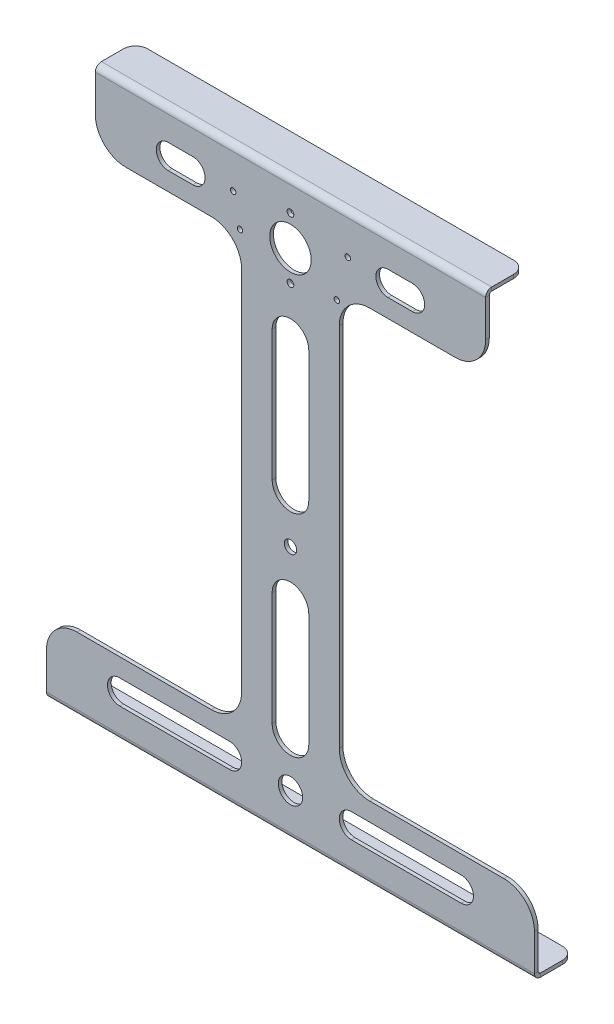
from build123d import *

# Parameters (mm, degrees)
ESQUISSE1_W                             = 400
ESQUISSE1_H                             = 470
BOSS_EXTRU_1_DEPTH                      = 3
T_LE_PLI_E_SUR_AR_TE1_STRIP_W           = 16
T_LE_PLI_E_SUR_AR_TE1_STRIP_H           = 3
T_LE_PLI_E_SUR_AR_TE1_STRIP_CUT_DEPTH   = 400
T_LE_PLI_E_SUR_AR_TE1_STRIP_2_W         = 16
T_LE_PLI_E_SUR_AR_TE1_STRIP_2_H         = 3
T_LE_PLI_E_SUR_AR_TE1_STRIP_CUT_2_DEPTH = 400
T_LE_PLI_E_SUR_AR_TE1_DEPTH             = 400
T_LE_PLI_E_SUR_AR_TE1_BEND_DEPTH        = 400
ENL_V_MAT_EXTRU_1_REACH                 = 513.849
ESQUISSE7_R                             = 17
ESQUISSE7_R_2                           = 5.1
ESQUISSE7_R_3                           = 2.75
ENL_V_MAT_EXTRU_2_REACH                 = 513.849
ESQUISSE12_R                            = 2.25
ESQUISSE12_R_2                          = 10
CONG_10_R                               = 10
CONG_2_R                                = 25
ESQUISSE13_R                            = 2.25
ENL_V_MAT_EXTRU_3_DEPTH                 = 10


# Sheet-metal steps are written as plain solids
with BuildPart() as part:
    # Esquisse1 → Boss.-Extru.1 (new body)
    with BuildSketch(Plane.XY):
        with Locations((0, 235)):
            Rectangle(ESQUISSE1_W, ESQUISSE1_H)
    extrude(amount=BOSS_EXTRU_1_DEPTH)

    # Tôle pliée sur arête1 strip (across the edge) → Tôle pliée sur arête1 strip cut (cut)
    with BuildSketch(Plane(origin=(-200, 470, 0), x_dir=(0, -1, 0), z_dir=(1, 0, 0))):
        with Locations((-3, -1.5)):
            Rectangle(T_LE_PLI_E_SUR_AR_TE1_STRIP_W, T_LE_PLI_E_SUR_AR_TE1_STRIP_H)
    extrude(amount=T_LE_PLI_E_SUR_AR_TE1_STRIP_CUT_DEPTH, mode=Mode.SUBTRACT)

    # Tôle pliée sur arête1 strip 2 (across the edge) → Tôle pliée sur arête1 strip cut 2 (cut)
    with BuildSketch(Plane(origin=(200, 0, 0), x_dir=(0, 1, 0), z_dir=(-1, 0, 0))):
        with Locations((-3, -1.5)):
            Rectangle(T_LE_PLI_E_SUR_AR_TE1_STRIP_2_W, T_LE_PLI_E_SUR_AR_TE1_STRIP_2_H)
    extrude(amount=T_LE_PLI_E_SUR_AR_TE1_STRIP_CUT_2_DEPTH, mode=Mode.SUBTRACT)

    # Tôle pliée sur arête1 section (across the edge) → Tôle pliée sur arête1 (add)
    with BuildSketch(Plane(origin=(-200, 470, 0), x_dir=(0, -1, 0), z_dir=(1, 0, 0))):
        with BuildLine():
            Line((0, 2), (0, 30))
            Line((0, 30), (3, 30))
            Line((3, 30), (3, 2))
            ThreePointArc((3, 2), (3.585786438, 0.585786438), (5, 0))
            Line((5, 0), (5, -3))
            ThreePointArc((5, -3), (1.464466094, -1.535533906), (0, 2))
        make_face()
    extrude(amount=T_LE_PLI_E_SUR_AR_TE1_DEPTH)

    # Tôle pliée sur arête1 section 2 (across the edge) → Tôle pliée sur arête1 bend (add)
    with BuildSketch(Plane(origin=(200, 0, 0), x_dir=(0, 1, 0), z_dir=(-1, 0, 0))):
        with BuildLine():
            Line((0, 2), (0, 30))
            Line((0, 30), (3, 30))
            Line((3, 30), (3, 2))
            ThreePointArc((3, 2), (3.585786438, 0.585786438), (5, 0))
            Line((5, 0), (5, -3))
            ThreePointArc((5, -3), (1.464466094, -1.535533906), (0, 2))
        make_face()
    extrude(amount=T_LE_PLI_E_SUR_AR_TE1_BEND_DEPTH)

    # Esquisse7 → Enlèv. mat.-Extru.1 (cut, up to next)
    with BuildSketch(Plane.XY.offset(3), mode=Mode.PRIVATE) as enl_v_mat_extru_1_sk1:
        with Locations((0, 420)):
            Circle(ESQUISSE7_R)
    enl_v_mat_extru_1_tool1 = extrude(enl_v_mat_extru_1_sk1.sketch, amount=-ENL_V_MAT_EXTRU_1_REACH, mode=Mode.PRIVATE) & part.part
    # Esquisse7 → Enlèv. mat.-Extru.1 (cut, up to next)
    with BuildSketch(Plane.XY.offset(3), mode=Mode.PRIVATE) as enl_v_mat_extru_1_sk2:
        with Locations((0, 208)):
            Circle(ESQUISSE7_R_2)
    enl_v_mat_extru_1_tool2 = extrude(enl_v_mat_extru_1_sk2.sketch, amount=-ENL_V_MAT_EXTRU_1_REACH, mode=Mode.PRIVATE) & part.part
    # Esquisse7 → Enlèv. mat.-Extru.1 (cut, up to next)
    with BuildSketch(Plane.XY.offset(3), mode=Mode.PRIVATE) as enl_v_mat_extru_1_sk3:
        with Locations((0, 395)):
            Circle(ESQUISSE7_R_3)
    enl_v_mat_extru_1_tool3 = extrude(enl_v_mat_extru_1_sk3.sketch, amount=-ENL_V_MAT_EXTRU_1_REACH, mode=Mode.PRIVATE) & part.part
    # Esquisse7 → Enlèv. mat.-Extru.1 (cut, up to next)
    with BuildSketch(Plane.XY.offset(3), mode=Mode.PRIVATE) as enl_v_mat_extru_1_sk4:
        with Locations((0, 445)):
            Circle(ESQUISSE7_R_3)
    enl_v_mat_extru_1_tool4 = extrude(enl_v_mat_extru_1_sk4.sketch, amount=-ENL_V_MAT_EXTRU_1_REACH, mode=Mode.PRIVATE) & part.part
    # Esquisse7 → Enlèv. mat.-Extru.1 (cut, up to next)
    with BuildSketch(Plane.XY.offset(3), mode=Mode.PRIVATE) as enl_v_mat_extru_1_sk5:
        with BuildLine():
            Line((-200, 60), (-65, 60))
            ThreePointArc((-65, 60), (-47.32233047, 67.32233047), (-40, 85))
            Line((-40, 85), (-40, 385))
            ThreePointArc((-40, 385), (-47.32233047, 402.67766953), (-65, 410))
            Line((-65, 410), (-160, 410))
            Line((-160, 410), (-160, 470))
            Line((-160, 470), (-200, 470))
            Line((-200, 470), (-200, 60))
        make_face()
    enl_v_mat_extru_1_tool5 = extrude(enl_v_mat_extru_1_sk5.sketch, amount=-ENL_V_MAT_EXTRU_1_REACH, mode=Mode.PRIVATE) & part.part
    # Esquisse7 → Enlèv. mat.-Extru.1 (cut, up to next)
    with BuildSketch(Plane.XY.offset(3), mode=Mode.PRIVATE) as enl_v_mat_extru_1_sk6:
        with BuildLine():
            Line((200.093993977, 470), (200.093993977, 60))
            Line((200.093993977, 60), (65, 60))
            ThreePointArc((65, 60), (47.32233047, 67.32233047), (40, 85))
            Line((40, 85), (40, 385))
            ThreePointArc((40, 385), (47.32233047, 402.67766953), (65, 410))
            Line((65, 410), (160, 410))
            Line((160, 410), (160, 470))
            Line((160, 470), (200.093993977, 470))
        make_face()
    enl_v_mat_extru_1_tool6 = extrude(enl_v_mat_extru_1_sk6.sketch, amount=-ENL_V_MAT_EXTRU_1_REACH, mode=Mode.PRIVATE) & part.part
    add(enl_v_mat_extru_1_tool1.solids().sort_by_distance((0, 420, 3))[0], mode=Mode.SUBTRACT)
    add(enl_v_mat_extru_1_tool2.solids().sort_by_distance((0, 208, 3))[0], mode=Mode.SUBTRACT)
    add(enl_v_mat_extru_1_tool3.solids().sort_by_distance((0, 395, 3))[0], mode=Mode.SUBTRACT)
    add(enl_v_mat_extru_1_tool4.solids().sort_by_distance((0, 445, 3))[0], mode=Mode.SUBTRACT)
    add(enl_v_mat_extru_1_tool5.solids().sort_by_distance((-122.820528, 243.463534, 3))[0], mode=Mode.SUBTRACT)
    add(enl_v_mat_extru_1_tool6.solids().sort_by_distance((122.87169, 243.477801, 3))[0], mode=Mode.SUBTRACT)

    # Esquisse12 → Enlèv. mat.-Extru.2 (cut, up to next)
    with BuildSketch(Plane.XY.offset(3), mode=Mode.PRIVATE) as enl_v_mat_extru_2_sk1:
        with Locations((38.064927056, 402.250033007)):
            Circle(ESQUISSE12_R)
    enl_v_mat_extru_2_tool1 = extrude(enl_v_mat_extru_2_sk1.sketch, amount=-ENL_V_MAT_EXTRU_2_REACH, mode=Mode.PRIVATE) & part.part
    # Esquisse12 → Enlèv. mat.-Extru.2 (cut, up to next)
    with BuildSketch(Plane.XY.offset(3), mode=Mode.PRIVATE) as enl_v_mat_extru_2_sk2:
        with Locations((-41.361925627, 412.706776538)):
            Circle(ESQUISSE12_R)
    enl_v_mat_extru_2_tool2 = extrude(enl_v_mat_extru_2_sk2.sketch, amount=-ENL_V_MAT_EXTRU_2_REACH, mode=Mode.PRIVATE) & part.part
    # Esquisse12 → Enlèv. mat.-Extru.2 (cut, up to next)
    with BuildSketch(Plane.XY.offset(3), mode=Mode.PRIVATE) as enl_v_mat_extru_2_sk3:
        with Locations((46.984631039, 437.101007166)):
            Circle(ESQUISSE12_R)
    enl_v_mat_extru_2_tool3 = extrude(enl_v_mat_extru_2_sk3.sketch, amount=-ENL_V_MAT_EXTRU_2_REACH, mode=Mode.PRIVATE) & part.part
    # Esquisse12 → Enlèv. mat.-Extru.2 (cut, up to next)
    with BuildSketch(Plane.XY.offset(3), mode=Mode.PRIVATE) as enl_v_mat_extru_2_sk4:
        with Locations((-46.984631039, 437.101007166)):
            Circle(ESQUISSE12_R)
    enl_v_mat_extru_2_tool4 = extrude(enl_v_mat_extru_2_sk4.sketch, amount=-ENL_V_MAT_EXTRU_2_REACH, mode=Mode.PRIVATE) & part.part
    # Esquisse12 → Enlèv. mat.-Extru.2 (cut, up to next)
    with BuildSketch(Plane.XY.offset(3), mode=Mode.PRIVATE) as enl_v_mat_extru_2_sk5:
        with Locations((0, 35)):
            Circle(ESQUISSE12_R_2)
    enl_v_mat_extru_2_tool5 = extrude(enl_v_mat_extru_2_sk5.sketch, amount=-ENL_V_MAT_EXTRU_2_REACH, mode=Mode.PRIVATE) & part.part
    # Esquisse12 → Enlèv. mat.-Extru.2 (cut, up to next)
    with BuildSketch(Plane.XY.offset(3), mode=Mode.PRIVATE) as enl_v_mat_extru_2_sk6:
        with BuildLine():
            Line((-15, 168), (-15, 75))
            ThreePointArc((-15, 75), (0, 60), (15, 75))
            Line((15, 75), (15, 168))
            ThreePointArc((15, 168), (0, 183), (-15, 168))
        make_face()
    enl_v_mat_extru_2_tool6 = extrude(enl_v_mat_extru_2_sk6.sketch, amount=-ENL_V_MAT_EXTRU_2_REACH, mode=Mode.PRIVATE) & part.part
    # Esquisse12 → Enlèv. mat.-Extru.2 (cut, up to next)
    with BuildSketch(Plane.XY.offset(3), mode=Mode.PRIVATE) as enl_v_mat_extru_2_sk7:
        with BuildLine():
            Line((140, 45), (50, 45))
            ThreePointArc((50, 45), (40, 35), (50, 25))
            Line((50, 25), (140, 25))
            ThreePointArc((140, 25), (150, 35), (140, 45))
        make_face()
    enl_v_mat_extru_2_tool7 = extrude(enl_v_mat_extru_2_sk7.sketch, amount=-ENL_V_MAT_EXTRU_2_REACH, mode=Mode.PRIVATE) & part.part
    # Esquisse12 → Enlèv. mat.-Extru.2 (cut, up to next)
    with BuildSketch(Plane.XY.offset(3), mode=Mode.PRIVATE) as enl_v_mat_extru_2_sk8:
        with BuildLine():
            Line((15, 355), (15, 248))
            ThreePointArc((15, 248), (0, 233), (-15, 248))
            Line((-15, 248), (-15, 355))
            ThreePointArc((-15, 355), (0, 370), (15, 355))
        make_face()
    enl_v_mat_extru_2_tool8 = extrude(enl_v_mat_extru_2_sk8.sketch, amount=-ENL_V_MAT_EXTRU_2_REACH, mode=Mode.PRIVATE) & part.part
    # Esquisse12 → Enlèv. mat.-Extru.2 (cut, up to next)
    with BuildSketch(Plane.XY.offset(3), mode=Mode.PRIVATE) as enl_v_mat_extru_2_sk9:
        with BuildLine():
            Line((-140, 45), (-50, 45))
            ThreePointArc((-50, 45), (-40, 35), (-50, 25))
            Line((-50, 25), (-140, 25))
            ThreePointArc((-140, 25), (-150, 35), (-140, 45))
        make_face()
    enl_v_mat_extru_2_tool9 = extrude(enl_v_mat_extru_2_sk9.sketch, amount=-ENL_V_MAT_EXTRU_2_REACH, mode=Mode.PRIVATE) & part.part
    # Esquisse12 → Enlèv. mat.-Extru.2 (cut, up to next)
    with BuildSketch(Plane.XY.offset(3), mode=Mode.PRIVATE) as enl_v_mat_extru_2_sk10:
        with BuildLine():
            Line((-100, 425), (-80, 425))
            ThreePointArc((-80, 425), (-70, 435), (-80, 445))
            Line((-80, 445), (-100, 445))
            ThreePointArc((-100, 445), (-110, 435), (-100, 425))
        make_face()
    enl_v_mat_extru_2_tool10 = extrude(enl_v_mat_extru_2_sk10.sketch, amount=-ENL_V_MAT_EXTRU_2_REACH, mode=Mode.PRIVATE) & part.part
    # Esquisse12 → Enlèv. mat.-Extru.2 (cut, up to next)
    with BuildSketch(Plane.XY.offset(3), mode=Mode.PRIVATE) as enl_v_mat_extru_2_sk11:
        with BuildLine():
            Line((80, 445), (100, 445))
            ThreePointArc((100, 445), (110, 435), (100, 425))
            Line((100, 425), (80, 425))
            ThreePointArc((80, 425), (70, 435), (80, 445))
        make_face()
    enl_v_mat_extru_2_tool11 = extrude(enl_v_mat_extru_2_sk11.sketch, amount=-ENL_V_MAT_EXTRU_2_REACH, mode=Mode.PRIVATE) & part.part
    add(enl_v_mat_extru_2_tool1.solids().sort_by_distance((38.064927, 402.250033, 3))[0], mode=Mode.SUBTRACT)
    add(enl_v_mat_extru_2_tool2.solids().sort_by_distance((-41.361926, 412.706777, 3))[0], mode=Mode.SUBTRACT)
    add(enl_v_mat_extru_2_tool3.solids().sort_by_distance((46.984631, 437.101007, 3))[0], mode=Mode.SUBTRACT)
    add(enl_v_mat_extru_2_tool4.solids().sort_by_distance((-46.984631, 437.101007, 3))[0], mode=Mode.SUBTRACT)
    add(enl_v_mat_extru_2_tool5.solids().sort_by_distance((0, 35, 3))[0], mode=Mode.SUBTRACT)
    add(enl_v_mat_extru_2_tool6.solids().sort_by_distance((0, 121.5, 3))[0], mode=Mode.SUBTRACT)
    add(enl_v_mat_extru_2_tool7.solids().sort_by_distance((95, 35, 3))[0], mode=Mode.SUBTRACT)
    add(enl_v_mat_extru_2_tool8.solids().sort_by_distance((0, 301.5, 3))[0], mode=Mode.SUBTRACT)
    add(enl_v_mat_extru_2_tool9.solids().sort_by_distance((-95, 35, 3))[0], mode=Mode.SUBTRACT)
    add(enl_v_mat_extru_2_tool10.solids().sort_by_distance((-90, 435, 3))[0], mode=Mode.SUBTRACT)
    add(enl_v_mat_extru_2_tool11.solids().sort_by_distance((90, 435, 3))[0], mode=Mode.SUBTRACT)

    # Congé 10
    cong_10_edges = [part.edges().sort_by_distance(p)[0] for p in [
        (160, 468.5, -30),
        (200, 1.5, -30),
        (-200, 1.5, -30),
        (-160, 468.5, -30),
    ]]
    fillet(cong_10_edges, radius=CONG_10_R)

    # Congé2
    cong_2_edges = [part.edges().sort_by_distance(p)[0] for p in [
        (200, 60, 1.5),
        (160, 410, 1.5),
        (-200, 60, 1.5),
        (-160, 410, 1.5),
    ]]
    fillet(cong_2_edges, radius=CONG_2_R)

    # Esquisse13 → Enlèv. mat.-Extru.3 (cut)
    with BuildSketch(Plane(origin=(0, 0, 0), x_dir=(-1, 0, 0), z_dir=(0, -1, 0))):
        with Locations(Location((175, 15, 0), (0, 0, 90))):
            Circle(ESQUISSE13_R)
        with Locations(Location((-175, 15, 0), (0, 0, 90))):
            Circle(ESQUISSE13_R)
    extrude(amount=-ENL_V_MAT_EXTRU_3_DEPTH, mode=Mode.SUBTRACT)


solid = part.part
